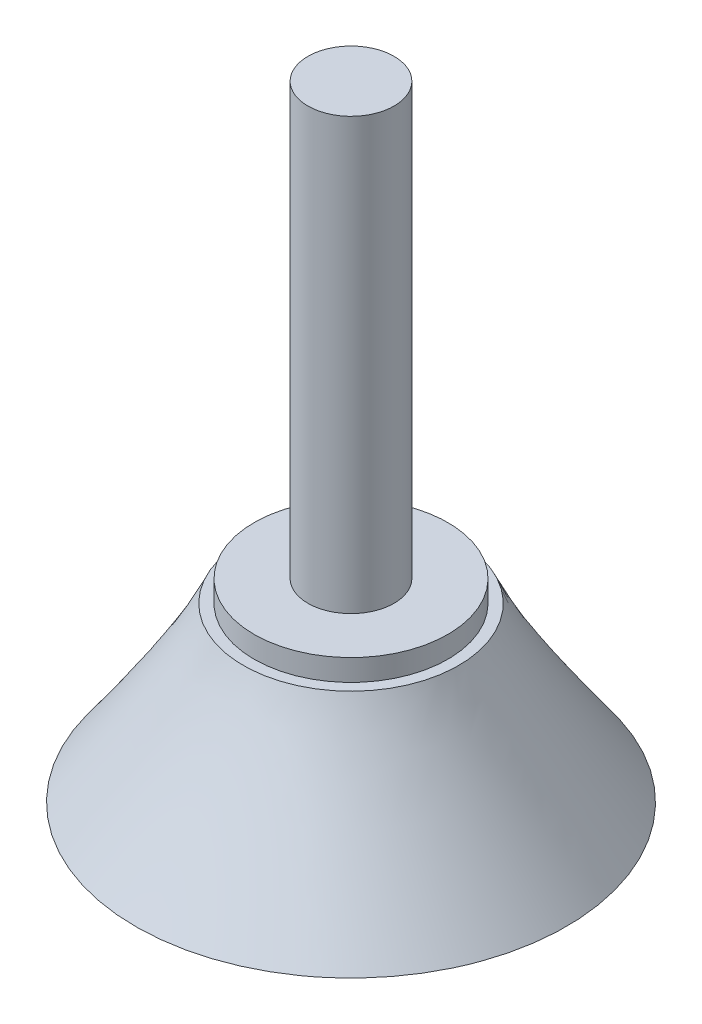
from build123d import *

# Parameters (mm, degrees)
SKETCH8_R           = 22.5
BOSS_EXTRUDE1_DEPTH = 5
SKETCH9_R           = 10
BOSS_EXTRUDE2_DEPTH = 100


with BuildPart() as part:
    # Loft1: read off the stored shape, not the designer's step
    # Loft1: loft between two sections, ruled curve by curve
    loft1_from = [
        Edge.make_bspline([(-39.813829713, 0, -30.246635574), (-100.307100862, 0, 49.381023853), (-20.679441435, 0, 109.874295001), (39.813829713, 0, 30.246635574), (100.307100862, 0, -49.381023853), (20.679441435, 0, -109.874295001), (-39.813829713, 0, -30.246635574)], [0, 0, 0, 0, 0.5, 0.5, 0.5, 1, 1, 1, 1], 3, [1, 0.333333333, 0.333333333, 1, 0.333333333, 0.333333333, 1]),
    ]
    loft1_to = [
        Edge.make_bspline([(-24.884570152, 40, -2.399618378), (-29.683806908, 40, 47.369521926), (20.085333396, 40, 52.168758681), (24.884570152, 40, 2.399618378), (29.683806908, 40, -47.369521926), (-20.085333396, 40, -52.168758681), (-24.884570152, 40, -2.399618378)], [0, 0, 0, 0, 0.5, 0.5, 0.5, 1, 1, 1, 1], 3, [1, 0.333333333, 0.333333333, 1, 0.333333333, 0.333333333, 1]),
    ]
    loft1 = Solid(Shell([*[Face.make_surface_from_curves(loft1_from[k], loft1_to[k]) for k in range(1)], Face(Wire(loft1_from)), Face(Wire(loft1_to))]))
    add(loft1)

    # Sketch8 → Boss-Extrude1 (add)
    with BuildSketch(Plane(origin=(0, 40, 0), x_dir=(1, 0, 0), z_dir=(0, 1, 0))):
        with Locations(Location((0, 0, 0), (0, 0, 270))):
            Circle(SKETCH8_R)
    extrude(amount=BOSS_EXTRUDE1_DEPTH)

    # Sketch9 → Boss-Extrude2 (add)
    with BuildSketch(Plane(origin=(0, 45, 0), x_dir=(1, 0, 0), z_dir=(0, 1, 0))):
        with Locations(Location((0, 0, 0), (0, 0, 270))):
            Circle(SKETCH9_R)
    extrude(amount=BOSS_EXTRUDE2_DEPTH)


solid = part.part
